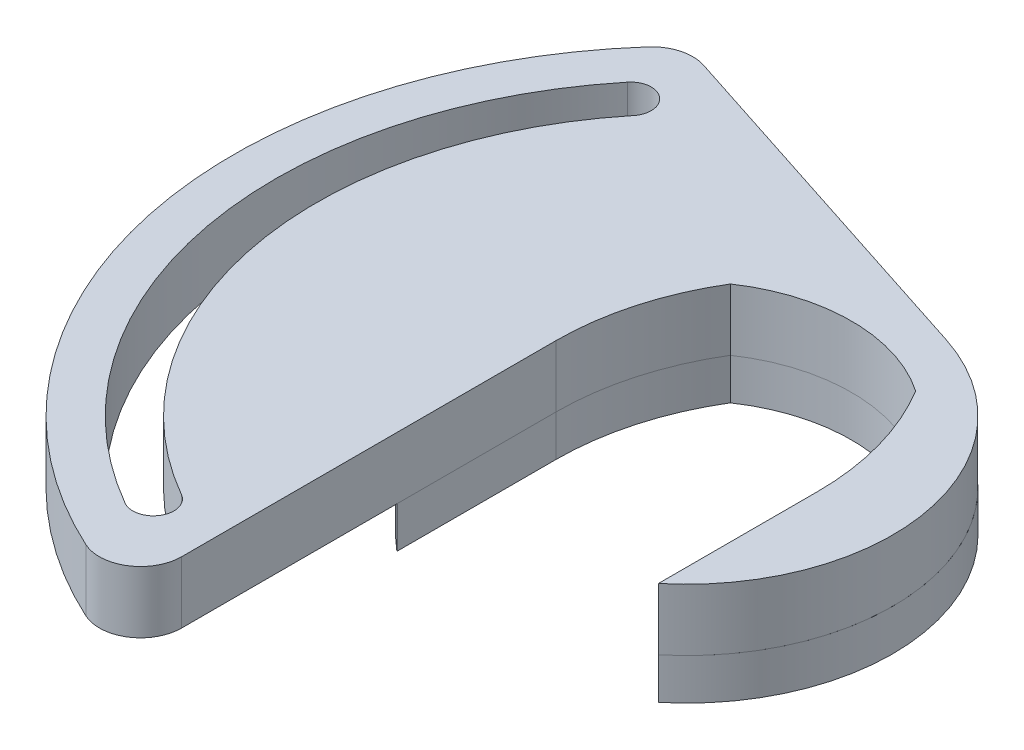
from build123d import *

# Parameters (mm, degrees)
BOSS_EXTRUDE1_DEPTH = 2
BOSS_EXTRUDE2_DEPTH = 3
FILLET1_R           = 2
CUT_EXTRUDE1_DEPTH  = 31.265023605


with BuildPart() as part:
    # Sketch1 → Boss-Extrude1 (new body)
    with BuildSketch(Plane(origin=(0, 0, 0), x_dir=(1, 0, 0), z_dir=(0, 1, 0))):
        with BuildLine():
            Line((-6.35, 0), (-6.35, -7.725121358))
            ThreePointArc((-6.35, -7.725121358), (0, 10), (6.35, -7.725121358))
            Line((6.35, -7.725121358), (6.35, 0))
            ThreePointArc((6.35, 0), (5.878792214, 3.434111967), (4.5, 6.614378278))
            ThreePointArc((4.5, 6.614378278), (0, 8), (-4.5, 6.614378278))
            ThreePointArc((-4.5, 6.614378278), (-5.878792214, 3.434111967), (-6.35, 0))
        make_face()
    extrude(amount=BOSS_EXTRUDE1_DEPTH)


with BuildPart() as body_2:
    # Sketch2 → Boss-Extrude2 (new body)
    with BuildSketch(Plane(origin=(0, 2, 0), x_dir=(1, 0, 0), z_dir=(0, 1, 0))):
        with BuildLine():
            Line((3.08424484, 9.512488306), (-15.556349186, 15.556349186))
            ThreePointArc((-15.556349186, 15.556349186), (-21.336077038, -5.363936672), (-6.35, -21.063653529))
            Line((-6.35, -21.063653529), (-6.35, -7.725121358))
            Line((-6.35, -7.725121358), (-6.35, 0))
            ThreePointArc((-6.35, 0), (-5.878792214, 3.434111967), (-4.5, 6.614378278))
            ThreePointArc((-4.5, 6.614378278), (0, 8), (4.5, 6.614378278))
            ThreePointArc((4.5, 6.614378278), (5.878792214, 3.434111967), (6.35, 0))
            Line((6.35, 0), (6.35, -7.725121358))
            ThreePointArc((6.35, -7.725121358), (9.825224713, 1.861440126), (3.08424484, 9.512488306))
        make_face()
    extrude(amount=BOSS_EXTRUDE2_DEPTH)

    # Fillet1
    fillet1_edges = [body_2.edges().sort_by_distance(p)[0] for p in [
        (-6.35, 3.5, 21.063653529),
        (-15.556349186, 3.5, -15.556349186),
    ]]
    fillet(fillet1_edges, radius=FILLET1_R)

    # Sketch3 → Cut-Extrude1 (cut, through all)
    with BuildSketch(Plane(origin=(0, 5, 0), x_dir=(1, 0, 0), z_dir=(0, 1, 0))):
        with BuildLine():
            ThreePointArc((-8.964059983, -15.57045729), (-8.596352651, -16.936030912), (-9.961926273, -17.303738245))
            ThreePointArc((-9.961926273, -17.303738245), (-19.63517441, -3.622051655), (-15.480132154, 12.610505177))
            ThreePointArc((-15.480132154, 12.610505177), (-14.073240591, 12.754227583), (-13.929518185, 11.34733602))
            ThreePointArc((-13.929518185, 11.34733602), (-17.668358144, -3.259237964), (-8.964059983, -15.57045729))
        make_face()
    extrude(amount=-CUT_EXTRUDE1_DEPTH, mode=Mode.SUBTRACT)


solid = Compound([part.part, body_2.part])
